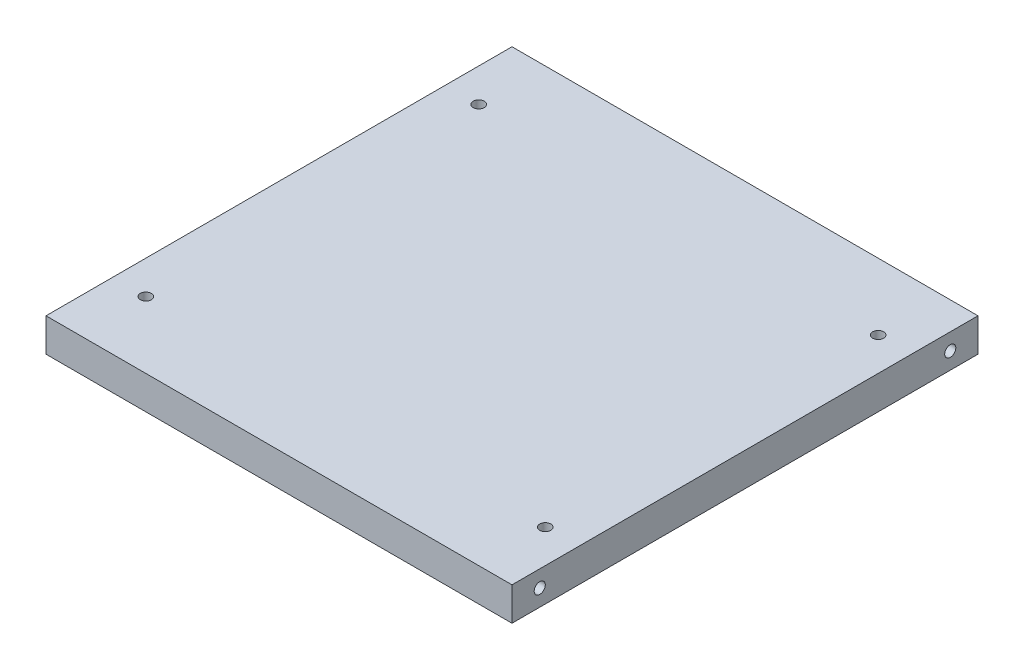
from build123d import *

# Parameters (mm, degrees)
SKETCH1_W            = 84
SKETCH1_H            = 84
BOSS_EXTRUDE1_DEPTH  = 6
SKETCH2_R            = 1
CUT_EXTRUDE1_DEPTH   = 6
LPATTERN1_COUNT      = 2
LPATTERN1_PITCH      = 72
LPATTERN1_COUNT_DIR2 = 2
LPATTERN1_PITCH_DIR2 = 60
SKETCH3_R            = 1
CUT_EXTRUDE2_DEPTH   = 10


with BuildPart() as part:
    # Sketch1 → Boss-Extrude1 (new body)
    with BuildSketch(Plane(origin=(0, 0, 0), x_dir=(1, 0, 0), z_dir=(0, 1, 0))):
        with Locations((42, 42)):
            Rectangle(SKETCH1_W, SKETCH1_H)
    extrude(amount=BOSS_EXTRUDE1_DEPTH)

    # Sketch2 → Cut-Extrude1 (cut)
    with BuildSketch(Plane(origin=(0, 6, 0), x_dir=(1, 0, 0), z_dir=(0, 1, 0))):
        with Locations((6, 72)):
            Circle(SKETCH2_R)
    cut_extrude1 = extrude(amount=-CUT_EXTRUDE1_DEPTH, mode=Mode.SUBTRACT)

    # LPattern1: Cut-Extrude1 2 × 2
    with Locations(*[(i * LPATTERN1_PITCH, 0, j * LPATTERN1_PITCH_DIR2) for i in range(LPATTERN1_COUNT) for j in range(LPATTERN1_COUNT_DIR2) if (i, j) != (0, 0)]):
        add(cut_extrude1, mode=Mode.SUBTRACT)

    # Sketch3 → Cut-Extrude2 (cut)
    with BuildSketch(Plane.ZY):
        with Locations((-79, 3)):
            Circle(SKETCH3_R)
        with Locations((-5, 3)):
            Circle(SKETCH3_R)
    cut_extrude2 = extrude(amount=-CUT_EXTRUDE2_DEPTH, mode=Mode.SUBTRACT)

    # Mirror1: Cut-Extrude2 across plane
    add(cut_extrude2.mirror(Plane.ZY.offset(-42)), mode=Mode.SUBTRACT)


solid = part.part
